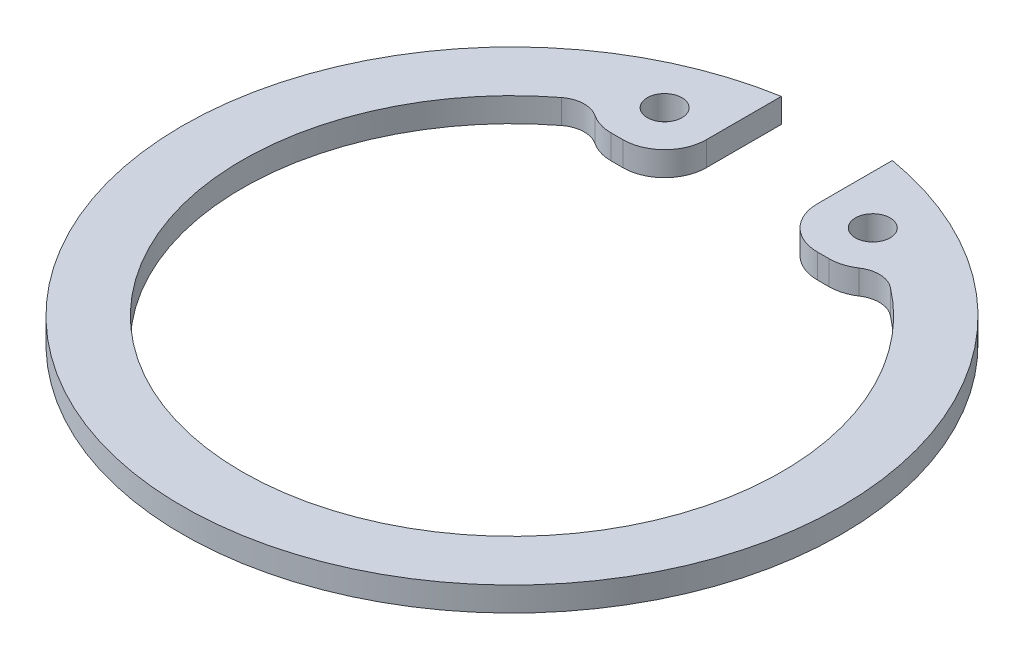
from build123d import *

# Parameters (mm, degrees)
BOSS_EXTRUDE1_DEPTH = 1.75
FILLET2_R           = 2
FILLET3_R           = 3
SKETCH2_R           = 1.2500000000000004
SKETCH2_R_2         = 1.2499999999999996
CUT_EXTRUDE1_DEPTH  = 1.75


with BuildPart() as part:
    # Sketch1 → Boss-Extrude1 (new body)
    with BuildSketch(Plane(origin=(0, 0, 0), x_dir=(1, 0, 0), z_dir=(0, 1, 0))):
        with BuildLine():
            Line((-4, 23.410734717218936), (-4, 19.03424545391805))
            Line((-4, 19.03424545391805), (-3.999999999999999, 15))
            Line((-3.999999999999999, 15), (-9, 15))
            Line((-9, 15), (-9, 17.242462121170515))
            ThreePointArc((-9, 17.242462121170515), (-3.57e-15, -19.45), (9, 17.242462121170515))
            Line((9, 17.242462121170515), (9.000000000000002, 15))
            Line((9.000000000000002, 15), (4, 15))
            Line((4, 15), (4, 19.034245453918047))
            Line((4, 19.034245453918047), (3.999999999999999, 23.410734717218936))
            ThreePointArc((3.999999999999999, 23.410734717218936), (-4.36e-15, -23.75), (-4, 23.410734717218936))
        make_face()
    extrude(amount=BOSS_EXTRUDE1_DEPTH)

    # Fillet2
    # the kernel refuses this fillet: 2 mm, written as the material it adds along each edge
    with BuildSketch(Plane(origin=(9.000000000000005, 0, -17.24246212117051), x_dir=(-2.38e-15, 0, 1), z_dir=(0, 1, 0))) as fillet2_piece_1:
        with BuildLine():
            CenterArc((3.4030154331547133, 1.62883885330701), FILLET2_R, 142.4753629283073, 92.05463357157004)
            Line((1.8168324316629296, 2.8470438794739996), (1.7851087716330947, 2.871407979997339))
            ThreePointArc((1.7851087716330947, 2.871407979997339), (0.812783961312924, 1.4845493734112696), (-0.0354600763417388, 0.01850899742930592))
            Line((-0.0354600763417388, 0.01850899742930592), (1e-16, -0.03999999999999915))
            ThreePointArc((1e-16, -0.03999999999999915), (1.1212310605852558, -0.04000000000000004), (2.219251054930826, -0.03257677706614009))
            Line((2.219251054930826, -0.03257677706614009), (2.24246212117051, 0))
        make_face()
    extrude(amount=1.75)
    with BuildSketch(Plane(origin=(-9, 0, -17.242462121170515), x_dir=(-0.842979895323632, 0, 0.5379450679020662), z_dir=(0, 1, 0))) as fillet2_piece_2:
        with BuildLine():
            CenterArc((3.203713774320002, 1.9924477660817068), FILLET2_R, 182.92614352023125, 92.05463357157015)
            Line((1.2063214380408842, 1.8903504841715306), (1.1663735913153022, 1.8883085385333274))
            ThreePointArc((1.1663735913153022, 1.8883085385333274), (0.5694415232074965, 0.966693044801846), (-0.03371919581294457, 0.02151780271608219))
            Line((-0.03371919581294457, 0.02151780271608219), (-0.00347286045996735, -0.03984895532163413))
            ThreePointArc((-0.00347286045996735, -0.03984895532163413), (1.68867839865919, -0.11344547485539745), (3.380829657778342, -0.03984895532163431))
            Line((3.380829657778342, -0.03984895532163431), (3.3773567973183756, 1.9e-16))
        make_face()
    extrude(amount=1.75)

    # Fillet3
    fillet3_edges = [part.edges().sort_by_distance(p)[0] for p in [
        (-9, 0.875, -15),
        (9.000000000000002, 0.875, -15),
        (4, 0.875, -15),
        (-3.999999999999999, 0.875, -15),
    ]]
    fillet(fillet3_edges, radius=FILLET3_R)

    # Sketch2 → Cut-Extrude1 (cut)
    with BuildSketch(Plane(origin=(0, 1.75, 0), x_dir=(1, 0, 0), z_dir=(0, 1, 0))):
        with Locations(Location((-7.5, 18.5, 0), (0, 0, 270))):
            Circle(SKETCH2_R)
        with Locations(Location((7.5, 18.5, 0), (0, 0, 270))):
            Circle(SKETCH2_R_2)
    extrude(amount=-CUT_EXTRUDE1_DEPTH, mode=Mode.SUBTRACT)


solid = part.part
